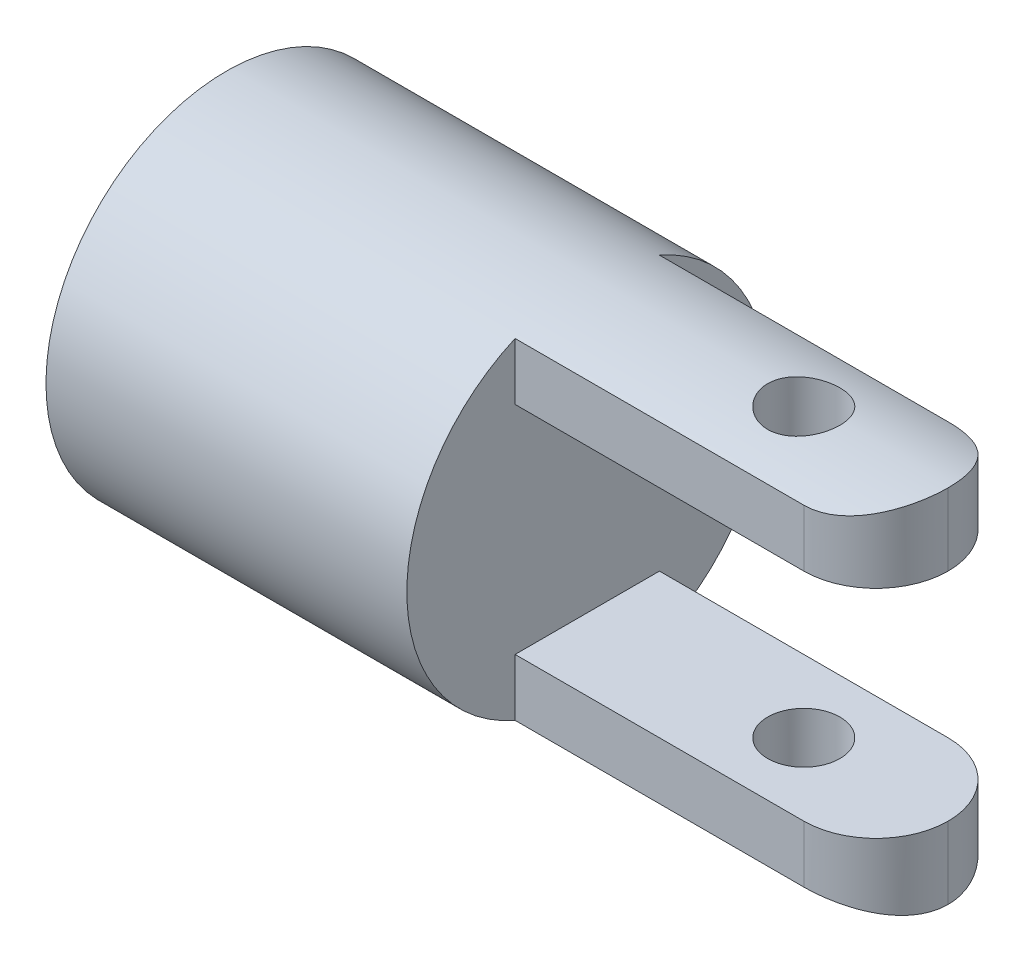
from build123d import *

# Parameters (mm, degrees)
SKIZZE7_R                            = 5
AUFSATZ_LINEAR_AUSTRAGEN4_DEPTH      = 10
SCHNITT_LINEAR_AUSTRAGEN2_DEPTH      = 13.247448714
SCHNITT_LINEAR_AUSTRAGEN2_DEPTH_BACK = 13.247448714
SKIZZE8_W                            = 10
SKIZZE8_H                            = 6
SCHNITT_LINEAR_AUSTRAGEN3_DEPTH      = 13.247448714
SCHNITT_LINEAR_AUSTRAGEN3_DEPTH_BACK = 13.247448714
SKIZZE5_R                            = 1
SKIZZE5_W                            = 10
SKIZZE5_H                            = 3
VERRUNDUNG1_R                        = 2


with BuildPart() as part:
    # Skizze7 → Aufsatz-Linear austragen4 (new, symmetric)
    with BuildSketch(Plane(origin=(0, 0, 0), x_dir=(0, 0, -1), z_dir=(1, 0, 0))):
        Circle(SKIZZE7_R)
    extrude(amount=AUFSATZ_LINEAR_AUSTRAGEN4_DEPTH, both=True)

    # Skizze8 → Schnitt-Linear austragen2 (cut, two sides: drawn at the far end of the back side and taken through both)
    with BuildSketch(Plane.XY.offset(-SCHNITT_LINEAR_AUSTRAGEN2_DEPTH_BACK)):
        with Locations((5, 0)):
            Rectangle(SKIZZE8_W, SKIZZE8_H)
    extrude(amount=SCHNITT_LINEAR_AUSTRAGEN2_DEPTH + SCHNITT_LINEAR_AUSTRAGEN2_DEPTH_BACK, mode=Mode.SUBTRACT)

    # Skizze5 → Schnitt-Linear austragen3 (cut, two sides: drawn at the far end of the back side and taken through both)
    with BuildSketch(Plane(origin=(0, 0, 0), x_dir=(1, 0, 0), z_dir=(0, 1, 0)).offset(-SCHNITT_LINEAR_AUSTRAGEN3_DEPTH_BACK)):
        with Locations(Location((6, 0, 0), (0, 0, 270))):
            Circle(SKIZZE5_R)
        with Locations((5, 3.5)):
            Rectangle(SKIZZE5_W, SKIZZE5_H)
        with Locations((5, -3.5)):
            Rectangle(SKIZZE5_W, SKIZZE5_H)
    extrude(amount=SCHNITT_LINEAR_AUSTRAGEN3_DEPTH + SCHNITT_LINEAR_AUSTRAGEN3_DEPTH_BACK, mode=Mode.SUBTRACT)

    # Verrundung1
    verrundung1_edges = [part.edges().sort_by_distance(p)[0] for p in [
        (10, -3.791287847, -2),
        (10, -3.791287847, 2),
        (10, 3.791287847, -2),
        (10, 3.791287847, 2),
    ]]
    fillet(verrundung1_edges, radius=VERRUNDUNG1_R - 0.0001)  # a hair under: the kernel refuses the full size


solid = part.part
